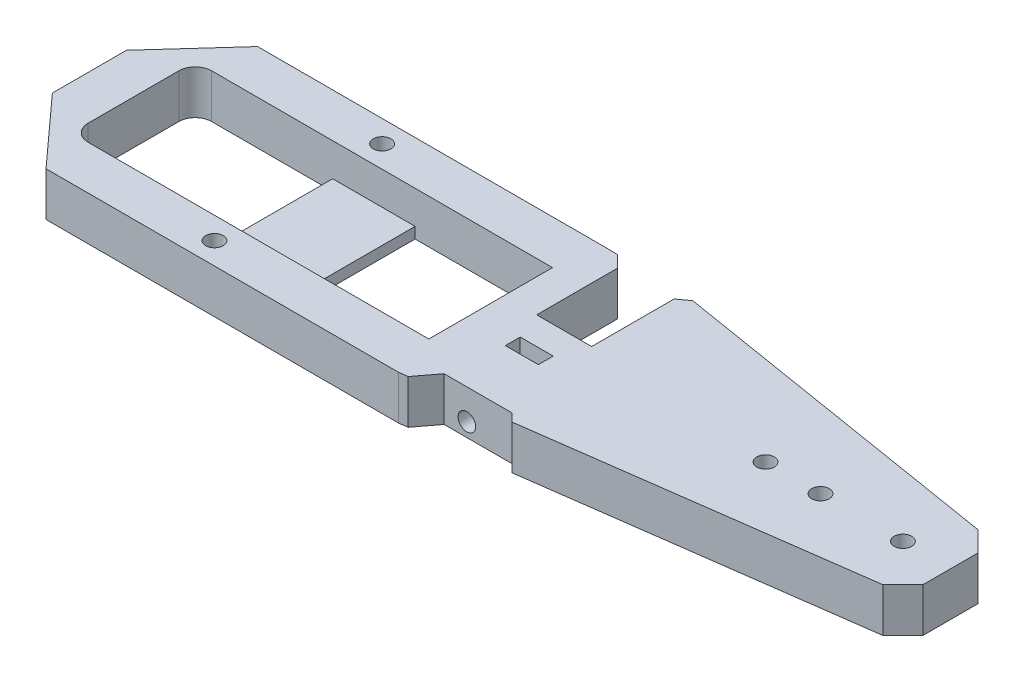
from build123d import *
from OCP.BRepFilletAPI import BRepFilletAPI_MakeChamfer

# Parameters (mm, degrees)
SKETCH2_R           = 1.6
SKETCH2_W           = 6
SKETCH2_H           = 2.7
BOSS_EXTRUDE1_DEPTH = 8
SKETCH4_W           = 15
SKETCH4_H           = 38.5
BOSS_EXTRUDE2_DEPTH = 2
CHAMFER2_SIZE       = 2
CHAMFER2_SIZE2      = 2.084999334
CHAMFER2_SIZE2_2    = 1.742047362
SKETCH3_R           = 1.6
CUT_EXTRUDE1_DEPTH  = 139.590988742
CUT_EXTRUDE2_DEPTH  = 2.4
LPATTERN1_COUNT     = 2
LPATTERN1_PITCH     = 10
SKETCH7_R           = 1.6
CUT_EXTRUDE3_DEPTH  = 139.241048657
CHAMFER4_SIZE       = 4.676123657
CHAMFER4_SIZE_2     = 4
CHAMFER5_SIZE       = 1.775919651
CHAMFER5_SIZE_2     = 2


with BuildPart() as part:
    # Sketch2 → Boss-Extrude1 (new body)
    with BuildSketch(Plane(origin=(0, 0, 0), x_dir=(1, 0, 0), z_dir=(0, 1, 0))):
        Polygon((-8.652082119, -19.25), (55.5, -19.25), (61, -18.498469641), (61, -15.329705671), (71.8782498, -15.329705671), (71.8782498, -17.012045101), (133, -8.660254038), (136.660254038, -5), (136.660254038, 0), (136.660254038, 5), (133, 8.660254038), (69, 19.11), (69, 2.370294329), (59, 2.370294329), (59, 19.11), (55.5, 19.25), (-8.652082119, 19.25), (-20, 6.739512223), (-20, -6.739512223), align=None)
        with Locations(Location((18, -15.25, 0), (0, 0, 270))):
            Circle(SKETCH2_R, mode=Mode.SUBTRACT)
        with BuildLine():
            ThreePointArc((-12, 8.25), (-11.121320344, 10.371320344), (-9, 11.25))
            Line((-9, 11.25), (53, 11.25))
            Line((53, 11.25), (53, -11.25))
            Line((53, -11.25), (-9, -11.25))
            ThreePointArc((-9, -11.25), (-11.121320344, -10.371320344), (-12, -8.25))
            Line((-12, -8.25), (-12, 8.25))
        make_face(mode=Mode.SUBTRACT)
        with Locations((64, -3.979705671)):
            Rectangle(SKETCH2_W, SKETCH2_H, mode=Mode.SUBTRACT)
        with Locations(Location((128, 0, 0), (0, 0, 270))):
            Circle(SKETCH2_R, mode=Mode.SUBTRACT)
        with Locations(Location((18, 15.25, 0), (0, 0, 270))):
            Circle(SKETCH2_R, mode=Mode.SUBTRACT)
    extrude(amount=BOSS_EXTRUDE1_DEPTH)

    # Sketch4 → Boss-Extrude2 (add)
    with BuildSketch(Plane(origin=(0, 0, 0), x_dir=(-1, 0, 0), z_dir=(0, -1, 0))):
        with Locations((-20.5, 0)):
            Rectangle(SKETCH4_W, SKETCH4_H)
    extrude(amount=-BOSS_EXTRUDE2_DEPTH)

    # Chamfer2: one chamfer whose edges measure the first distance from different faces: ONE call of the kernel's chamfer builder (chamfer() names one face for all edges)
    chamfer2_edges_1 = [part.edges().sort_by_distance(p)[0] for p in [
        (59, 4, -19.11),
    ]]
    chamfer2_side_1 = [part.faces().sort_by_distance(p)[0] for p in [
        (59, 4, -10.740147164),
    ]]
    chamfer2_edges_2 = [part.edges().sort_by_distance(p)[0] for p in [
        (69, 4, -19.11),
    ]]
    chamfer2_side_2 = [part.faces().sort_by_distance(p)[0] for p in [
        (101, 4, -13.885127019),
    ]]
    chamfer2 = BRepFilletAPI_MakeChamfer(part.part.solid().wrapped)
    for e in chamfer2_edges_1:
        chamfer2.Add(CHAMFER2_SIZE, CHAMFER2_SIZE2, e.wrapped, chamfer2_side_1[0].wrapped)  # the first distance lies on this face
    for e in chamfer2_edges_2:
        chamfer2.Add(CHAMFER2_SIZE, CHAMFER2_SIZE2_2, e.wrapped, chamfer2_side_2[0].wrapped)  # the first distance lies on this face
    add(Compound.cast(chamfer2.Shape()), mode=Mode.REPLACE)

    # Sketch3 → Cut-Extrude1 (cut, through all)
    with BuildSketch(Plane(origin=(0, 0, -2.370294329), x_dir=(-1, 0, 0), z_dir=(0, 0, -1))):
        with Locations((-64, 2.5)):
            Circle(SKETCH3_R)
    extrude(amount=-CUT_EXTRUDE1_DEPTH, mode=Mode.SUBTRACT)

    # Sketch5 → Cut-Extrude2 (cut)
    with BuildSketch(Plane.XZ):
        Polygon((21.061742947, 14.043463581), (20.575762662, 17.298278962), (17.514019716, 18.504815381), (14.938257053, 16.456536419), (15.424237338, 13.201721038), (18.485980284, 11.995184619), align=None)
        Polygon((21.488981661, -15.788699565), (20.211018339, -12.49780303), (16.722036677, -11.959103466), (14.511018339, -14.711300435), (15.788981661, -18.00219697), (19.277963323, -18.540896534), align=None)
    extrude(amount=-CUT_EXTRUDE2_DEPTH, mode=Mode.SUBTRACT)

    # Sketch6 → Cut-Revolve1 (revolve, cut)
    with BuildSketch(Plane.XY, mode=Mode.PRIVATE) as cut_revolve1_sk:
        Polygon((113, 0), (113, 3.3), (109.7, 0), align=None)
    cut_revolve1 = revolve(cut_revolve1_sk.sketch.rotate(Axis((113, 0, 0), (0, 1, 0)), 270), axis=Axis((113, 0, 0), (0, 1, 0)), mode=Mode.SUBTRACT)

    # LPattern1: Cut-Revolve1 ×2
    with Locations(*[(-i * LPATTERN1_PITCH, 0, 0) for i in range(1, LPATTERN1_COUNT)]):
        add(cut_revolve1, mode=Mode.SUBTRACT)

    # Sketch7 → Cut-Extrude3 (cut, through all)
    with BuildSketch(Plane.XZ):
        with Locations(Location((113, 0, 0), (0, 0, 270))):
            Circle(SKETCH7_R)
        with Locations(Location((103, 0, 0), (0, 0, 270))):
            Circle(SKETCH7_R)
    extrude(amount=-CUT_EXTRUDE3_DEPTH, mode=Mode.SUBTRACT)

    # Chamfer4
    # the kernel refuses this chamfer: 4.676123657, 4 mm, written as the material it takes off along each edge
    with BuildSketch(Plane(origin=(61, -12.065997261, 18.498469641), x_dir=(0.023441304216062758, 0, -0.9997252148748925), z_dir=(0, 1, 0))) as chamfer4_piece_1_section:
        Polygon((CHAMFER4_SIZE * 0.999725214943, CHAMFER4_SIZE * 0.0234413042177), (-CHAMFER4_SIZE_2 * 0.158572136068, CHAMFER4_SIZE_2 * 0.98734739462), (0, 0), align=None)
    chamfer4_piece_1 = extrude(amount=32.131994523, mode=Mode.PRIVATE)
    chamfer4_piece_1 = split(chamfer4_piece_1, bisect_by=Plane(origin=(59.577955858, 4, 15.329705671), z_dir=(0, 0, 1)), keep=Keep.TOP, mode=Mode.PRIVATE)
    add(chamfer4_piece_1, mode=Mode.SUBTRACT)

    # Chamfer5
    # the kernel refuses this chamfer: 2, 1.775919651 mm, written as the material it takes off along each edge
    with BuildSketch(Plane(origin=(71.8782498, -5.143365976, 17.012045101), x_dir=(0.9949144836162346, 0, -0.10072323610091762), z_dir=(0, 1, 0))) as chamfer5_piece_1_section:
        Polygon((CHAMFER5_SIZE * 0.999390828495, CHAMFER5_SIZE * 0.0348994555423), (CHAMFER5_SIZE_2 * 0.100723236101, CHAMFER5_SIZE_2 * 0.994914483616), (0, 0), align=None)
    chamfer5_piece_1 = extrude(amount=18.286731952, mode=Mode.PRIVATE)
    chamfer5_piece_1 = split(chamfer5_piece_1, bisect_by=Plane(origin=(72.478635966, 4, 15.329705671), z_dir=(0, 0, 1)), keep=Keep.TOP, mode=Mode.PRIVATE)
    add(chamfer5_piece_1, mode=Mode.SUBTRACT)


solid = part.part
